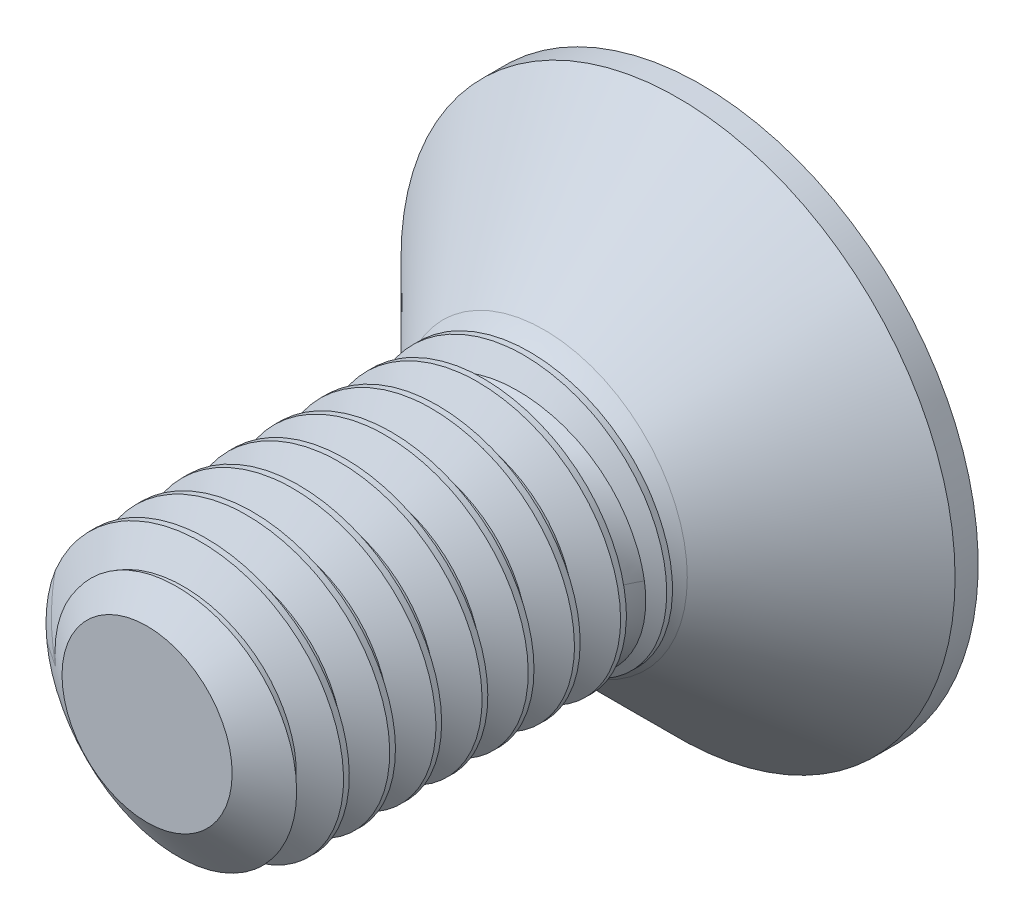
from build123d import *

# Parameters (mm, degrees)
SKETCH1_R          = 1.5
EXTRUDE1_DEPTH     = 6
CUT_SWEEP1_PITCH   = 0.5
SKETCH6_R          = 3
EXTRUDE2_DEPTH     = 1.7
CUT_EXTRUDE1_DEPTH = 1.5
SKETCH8_R          = 1.154700538
CUT_EXTRUDE2_DEPTH = 8.34846931
CUT_EXTRUDE2_TAPER = 45


with BuildPart() as part:
    # Sketch1 → Extrude1 (new body)
    with BuildSketch(Plane.XY):
        Circle(SKETCH1_R)
    extrude(amount=-EXTRUDE1_DEPTH)

    # Cut-Sweep1: the profile of Sketch3 profile screwed along a right-hand helix of 13 turns, 6 arcs to a turn; built about Z, then put on its axis
    cut_sweep1_z = Axis((0, 0, 0), (0, 0, 1))
    cut_sweep1_corners = [(1.5003, 0, -0.437673205), (1.175240474, 0, -0.25), (1.175240474, 0, -0.1875), (1.5003, 0, 0.000173205)]
    with BuildLine(mode=Mode.PRIVATE) as cut_sweep1_profile:
        Line(cut_sweep1_corners[0], cut_sweep1_corners[1])
        Line(cut_sweep1_corners[1], cut_sweep1_corners[2])
        Line(cut_sweep1_corners[2], cut_sweep1_corners[3])
        Line(cut_sweep1_corners[3], cut_sweep1_corners[0])
    cut_sweep1_cap = Face(cut_sweep1_profile.wire())
    cut_sweep1_turn_angles = [0, 30, 60, 90, 120, 150, 180, 210, 240, 270, 300, 330, 360]
    cut_sweep1_turn_weights = [1, 0.8660254037844387, 1, 0.8660254037844387, 1, 0.8660254037844387, 1, 0.8660254037844387, 1, 0.8660254037844387, 1, 0.8660254037844387, 1]
    cut_sweep1_turn_rails = [Edge.make_bspline([Vector(p[0], p[1], 0).rotate(cut_sweep1_z, cut_sweep1_turn_angles[k]) / cut_sweep1_turn_weights[k] + Vector(0, 0, p[2] + CUT_SWEEP1_PITCH * cut_sweep1_turn_angles[k] / 360) for k in range(13)], [0, 0, 0, 1, 1, 2, 2, 3, 3, 4, 4, 5, 5, 6, 6, 6], 2, cut_sweep1_turn_weights) for p in cut_sweep1_corners]
    cut_sweep1_turn_sides = [Face.make_surface_from_curves(cut_sweep1_turn_rails[p[0]], cut_sweep1_turn_rails[p[1]]) for p in [(0, 1), (1, 2), (2, 3), (3, 0)]]
    cut_sweep1 = Plane(origin=(0, 0, 0), x_dir=(0, 1, 0), z_dir=(0, 0, -1)) * Solid(Shell([*[p.moved(Location((0, 0, CUT_SWEEP1_PITCH * i))) for i in range(13) for p in cut_sweep1_turn_sides], cut_sweep1_cap, cut_sweep1_cap.rotate(cut_sweep1_z, 4680).moved(Location((0, 0, CUT_SWEEP1_PITCH * 4680 / 360)))]))
    add(cut_sweep1, mode=Mode.SUBTRACT)

    # Sketch4 → Cut-Revolve1 (revolve, cut)
    with BuildSketch(Plane(origin=(0, 0, 0), x_dir=(0, 0, -1), z_dir=(1, 0, 0)), mode=Mode.PRIVATE) as cut_revolve1_sk:
        Polygon((0.405251783, 1.5), (0, 0.921240474), (0, 1.5), align=None)
    revolve(cut_revolve1_sk.sketch.rotate(Axis((0, 0, 0), (0, 0, -1)), 263.352109169), axis=Axis((0, 0, 0), (0, 0, -1)), mode=Mode.SUBTRACT)

    # Sketch6 → Extrude2 (add)
    with BuildSketch(Plane(origin=(0, 0, -6), x_dir=(-1, 0, 0), z_dir=(0, 0, -1))):
        Circle(SKETCH6_R)
    extrude(amount=-EXTRUDE2_DEPTH)

    # Sketch10 → Cut-Revolve2 (revolve, cut)
    with BuildSketch(Plane(origin=(0, 0, 0), x_dir=(0, 0, -1), z_dir=(1, 0, 0)), mode=Mode.PRIVATE) as cut_revolve2_sk:
        Polygon((5.75, -3), (4.3, -1.55), (4.3, -3), align=None)
    revolve(cut_revolve2_sk.sketch.rotate(Axis((0, 0, 0), (0, 0, -1)), 270), axis=Axis((0, 0, 0), (0, 0, -1)), mode=Mode.SUBTRACT)

    # Sketch11 → Revolve1 (revolve)
    with BuildSketch(Plane(origin=(0, 0, 0), x_dir=(0, 0, -1), z_dir=(1, 0, 0)), mode=Mode.PRIVATE) as revolve1_sk:
        with BuildLine():
            Line((3.395250469, 1.175240474), (3.395250469, 0))
            Line((3.395250469, 0), (4.3, 0))
            Line((4.3, 0), (4.3, 1.55))
            ThreePointArc((4.3, 1.55), (3.884897387, 1.272637301), (3.395250469, 1.175240474))
        make_face()
    revolve(revolve1_sk.sketch.rotate(Axis((0, 0, 0), (0, 0, -1)), 90), axis=Axis((0, 0, 0), (0, 0, -1)))

    # Sketch7 → Cut-Extrude1 (cut)
    with BuildSketch(Plane.XY.offset(-6)):
        Polygon((0, 1.154700538), (-1, 0.577350269), (-1, -0.577350269), (0, -1.154700538), (1, -0.577350269), (1, 0.577350269), align=None)
    extrude(amount=CUT_EXTRUDE1_DEPTH, mode=Mode.SUBTRACT)

    # Sketch8 → Cut-Extrude2 (cut, through all)
    with BuildSketch(Plane.XY.offset(-6)):
        Circle(SKETCH8_R)
    extrude(amount=CUT_EXTRUDE2_DEPTH, taper=CUT_EXTRUDE2_TAPER, mode=Mode.SUBTRACT)


solid = part.part
